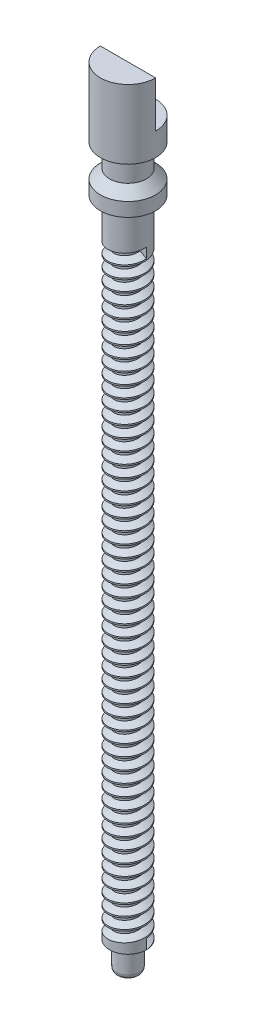
from build123d import *

# Parameters (mm, degrees)
FILLET2_R          = 0.1
THREAD1_PITCH      = 0.25
CUT_EXTRUDE1_DEPTH = 1


with BuildPart() as part:
    # Sketch1 → Revolve1 (revolve)
    with BuildSketch(Plane.XY, mode=Mode.PRIVATE) as revolve1_sk:
        Polygon((0, 0), (0.25, 0), (0.25, 0.6), (0.4, 0.6), (0.4, 13.6), (0.4, 14.6), (0.6, 14.6), (0.6, 14.9), (0.4, 15.1), (0.4, 15.6), (0.6, 15.6), (0.6, 17.1), (0, 17.1), align=None)
    revolve(revolve1_sk.sketch.rotate(Axis((0, 0, 0), (0, 1, 0)), 90), axis=Axis((0, 0, 0), (0, 1, 0)))

    # Fillet2
    fillet2_edges = [part.edges().sort_by_distance(p)[0] for p in [
        (0, 0, 0.25),
    ]]
    fillet(fillet2_edges, radius=FILLET2_R)

    # Thread1: arcs per turn and ends read off the stored shape
    # Thread1: the profile of Thread Profile2 profile screwed along a right-hand helix through 52.0004 turns, 6 arcs to a turn; built about Z, then put on its axis
    thread1_z = Axis((0, 0, 0), (0, 0, 1))
    thread1_corners = [(0.4003, 0, -0.000173205), (0.4003, 0, 0.218923204), (0.264683531, 0, 0.140625), (0.264683531, 0, 0.078125)]
    with BuildLine(mode=Mode.PRIVATE) as thread1_profile:
        Line(thread1_corners[0], thread1_corners[1])
        Line(thread1_corners[1], thread1_corners[2])
        Line(thread1_corners[2], thread1_corners[3])
        Line(thread1_corners[3], thread1_corners[0])
    thread1_cap = Face(thread1_profile.wire())
    thread1_turn_angles = [0, 30, 60, 90, 120, 150, 180, 210, 240, 270, 300, 330, 360]
    thread1_turn_weights = [1, 0.8660254037844387, 1, 0.8660254037844387, 1, 0.8660254037844387, 1, 0.8660254037844387, 1, 0.8660254037844387, 1, 0.8660254037844387, 1]
    thread1_turn_rails = [Edge.make_bspline([Vector(p[0], p[1], 0).rotate(thread1_z, thread1_turn_angles[k]) / thread1_turn_weights[k] + Vector(0, 0, p[2] + THREAD1_PITCH * thread1_turn_angles[k] / 360) for k in range(13)], [0, 0, 0, 1, 1, 2, 2, 3, 3, 4, 4, 5, 5, 6, 6, 6], 2, thread1_turn_weights) for p in thread1_corners]
    thread1_turn_sides = [Face.make_surface_from_curves(thread1_turn_rails[p[0]], thread1_turn_rails[p[1]]) for p in [(0, 1), (1, 2), (2, 3), (3, 0)]]
    thread1_last_angles = [18720, 18720.072, 18720.144]
    thread1_last_weights = [1, 0.9999992104317518, 1]
    thread1_last_rails = [Edge.make_bspline([Vector(p[0], p[1], 0).rotate(thread1_z, thread1_last_angles[k]) / thread1_last_weights[k] + Vector(0, 0, p[2] + THREAD1_PITCH * thread1_last_angles[k] / 360) for k in range(3)], [0, 0, 0, 1, 1, 1], 2, thread1_last_weights) for p in thread1_corners]
    thread1_last_sides = [Face.make_surface_from_curves(thread1_last_rails[p[0]], thread1_last_rails[p[1]]) for p in [(0, 1), (1, 2), (2, 3), (3, 0)]]
    thread1 = Plane(origin=(0, 0.5999, 0), x_dir=(1, 0, 0), z_dir=(0, 1, 0)) * Solid(Shell([*[p.moved(Location((0, 0, THREAD1_PITCH * i))) for i in range(52) for p in thread1_turn_sides], *thread1_last_sides, thread1_cap, thread1_cap.rotate(thread1_z, 18720.144).moved(Location((0, 0, THREAD1_PITCH * 18720.144 / 360)))]))
    add(thread1, mode=Mode.SUBTRACT)

    # Sketch3 → Cut-Extrude1 (cut)
    with BuildSketch(Plane(origin=(0, 17.1, 0), x_dir=(1, 0, 0), z_dir=(0, 1, 0))):
        with BuildLine():
            Line((-0.6, 0), (0.6, 0))
            ThreePointArc((0.6, 0), (0, 0.6), (-0.6, 0))
        make_face()
    extrude(amount=-CUT_EXTRUDE1_DEPTH, mode=Mode.SUBTRACT)


solid = part.part
